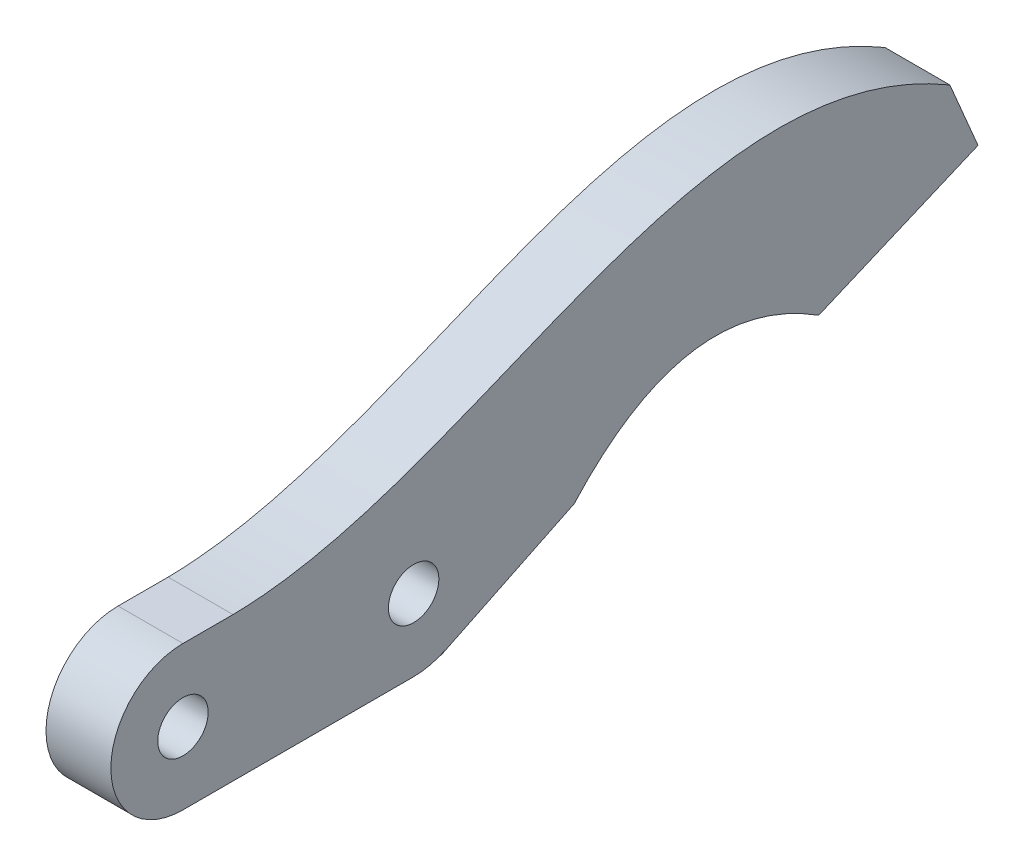
from build123d import *

# Parameters (mm, degrees)
SKETCH1_R           = 1.75
BOSS_EXTRUDE1_DEPTH = 4.5
BOSS_EXTRUDE2_START = -4.5
BOSS_EXTRUDE2_DEPTH = 4.5


with BuildPart() as part:
    # Sketch1 → Boss-Extrude1 (new body)
    with BuildSketch(Plane(origin=(0, 0, 0), x_dir=(0, 0, -1), z_dir=(1, 0, 0))):
        with BuildLine():
            Line((21, 10), (5, 10))
            ThreePointArc((5, 10), (0, 5), (5, 0))
            Line((5, 0), (21, 0))
            ThreePointArc((21, 0), (26, 5), (21, 10))
        make_face()
        with Locations((5, 5)):
            Circle(SKETCH1_R, mode=Mode.SUBTRACT)
        with Locations((21, 5)):
            Circle(SKETCH1_R, mode=Mode.SUBTRACT)
    extrude(amount=BOSS_EXTRUDE1_DEPTH)

    # Sketch2 → Boss-Extrude2 (add)
    with BuildSketch(Plane(origin=(4.5, 0, 5.948752288), x_dir=(0, 0, -1), z_dir=(1, 0, 0)).offset(BOSS_EXTRUDE2_START)):
        with BuildLine():
            add(Edge.make_bspline(
                [(64.143181637, 16.951696957), (46.612317697, 27.329270704), (31.598837725, 10.239754373), (14.42062821, 10)],
                knots=[0, 0, 0, 0, 0.986139084, 0.986139084, 0.986139084, 0.986139084], degree=3))
            Line((14.42062821, 10), (26.948752288, 10))
            ThreePointArc((26.948752288, 10), (31.805502669, 6.188265854), (29.257196543, 0.564790296))
            ThreePointArc((29.257196543, 0.564790296), (29.043850891, 0.440925909), (28.824655416, 0.327735373))
            Line((28.824655416, 0.327735373), (38.08542066, 4.824084077))
            add(Edge.make_bspline(
                [(38.08542066, 4.824084077), (45.879227883, 13.481709162), (55.04551447, 7.665553941)],
                knots=[0, 0, 0, 1, 1, 1], degree=2))
            Line((55.04551447, 7.665553941), (66.094228393, 12.348066156))
            Line((66.094228393, 12.348066156), (64.143181637, 16.951696957))
        make_face()
    extrude(amount=BOSS_EXTRUDE2_DEPTH)


solid = part.part
